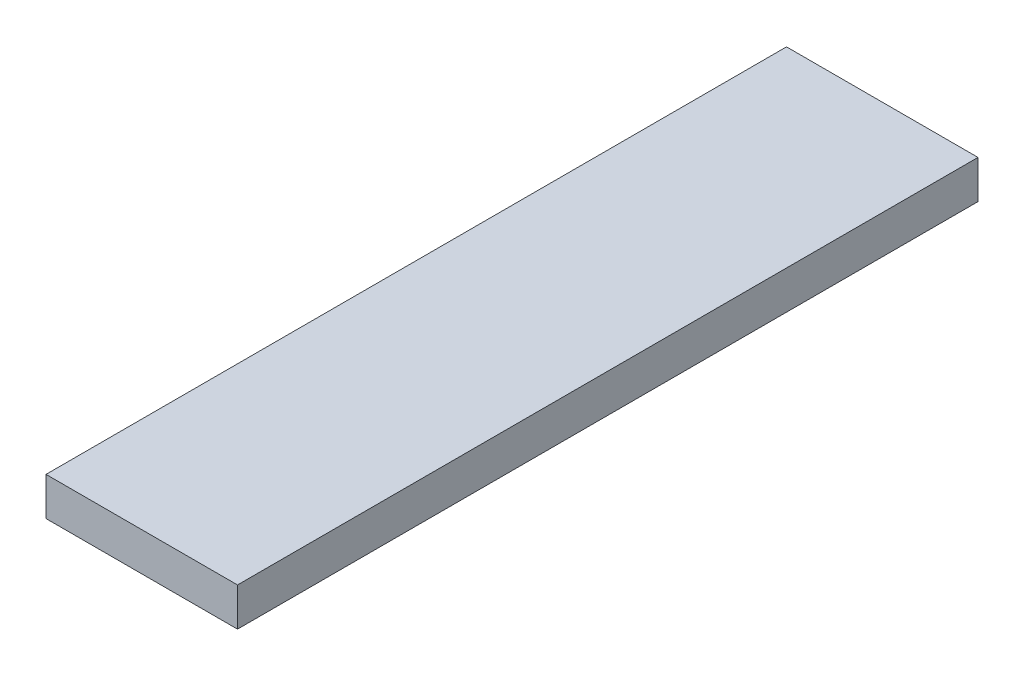
from build123d import *

# Parameters (mm, degrees)
SKETCH1_W           = 190.5
SKETCH1_H           = 38.1
BOSS_EXTRUDE1_DEPTH = 736.6


with BuildPart() as part:
    # Sketch1 → Boss-Extrude1 (new body)
    with BuildSketch(Plane.XY):
        with Locations((95.25, 19.05)):
            Rectangle(SKETCH1_W, SKETCH1_H)
    extrude(amount=BOSS_EXTRUDE1_DEPTH)


solid = part.part
